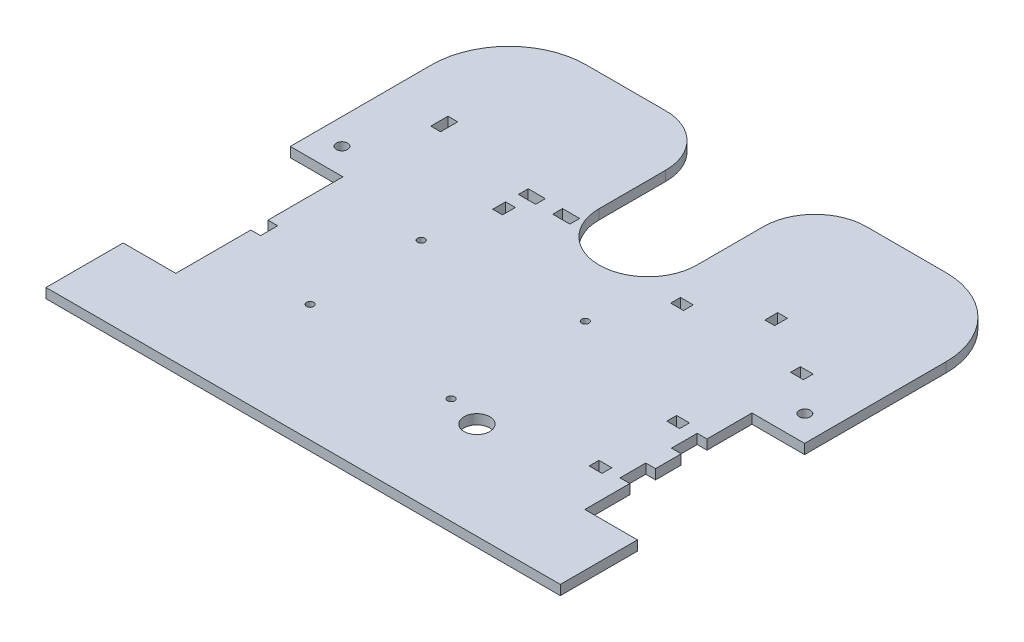
from build123d import *

# Parameters (mm, degrees)
SKETCH1_W           = 254
SKETCH1_H           = 228.6
BOSS_EXTRUDE1_DEPTH = 4.826
SKETCH2_W           = 26.00000007
SKETCH2_H           = 82.55
CUT_EXTRUDE1_DEPTH  = 4.826
CUT_EXTRUDE3_DEPTH  = 4.826
SKETCH17_R          = 2.778125
CUT_EXTRUDE14_DEPTH = 171.929167423
SKETCH18_W          = 4.826
SKETCH18_H          = 12.7
CUT_EXTRUDE15_DEPTH = 171.929167423
SKETCH19_W          = 4.826
SKETCH19_H          = 8.466666666
CUT_EXTRUDE16_DEPTH = 171.929167423
SKETCH20_W          = 6.35
SKETCH20_H          = 4.826
CUT_EXTRUDE17_DEPTH = 4.826
SKETCH21_R          = 1.778
CUT_EXTRUDE18_DEPTH = 171.929167423
SKETCH22_R          = 6.35
CUT_EXTRUDE19_DEPTH = 171.929167423
SKETCH24_R          = 24.13
CUT_EXTRUDE21_DEPTH = 171.929167423
SKETCH26_W          = 6.35
SKETCH26_H          = 4.826
SKETCH26_W_2        = 4.826
SKETCH26_H_2        = 6.35
CUT_EXTRUDE23_DEPTH = 171.929167423
SKETCH27_W          = 8.466666666
SKETCH27_H          = 4.826
SKETCH27_W_2        = 8.466666667
SKETCH27_W_3        = 4.826
SKETCH27_H_2        = 6.35
CUT_EXTRUDE24_DEPTH = 171.929167423
CUT_EXTRUDE25_DEPTH = 171.929167423
FILLET1_R           = 25.4


with BuildPart() as part:
    # Sketch1 → Boss-Extrude1 (new body)
    with BuildSketch(Plane(origin=(0, 0, 0), x_dir=(1, 0, 0), z_dir=(0, 1, 0))):
        Rectangle(SKETCH1_W, SKETCH1_H)
    extrude(amount=BOSS_EXTRUDE1_DEPTH)

    # Sketch2 → Cut-Extrude1 (cut)
    with BuildSketch(Plane(origin=(0, 4.826, 0), x_dir=(1, 0, 0), z_dir=(0, 1, 0))):
        with Locations((-113.999999965, -34.925)):
            Rectangle(SKETCH2_W, SKETCH2_H)
        with Locations((113.999999965, -34.925)):
            Rectangle(SKETCH2_W, SKETCH2_H)
    extrude(amount=-CUT_EXTRUDE1_DEPTH, mode=Mode.SUBTRACT)

    # Sketch4 → Cut-Extrude3 (cut)
    with BuildSketch(Plane(origin=(0, 4.826, 0), x_dir=(1, 0, 0), z_dir=(0, 1, 0))):
        with BuildLine():
            Line((-127, 76.2), (-127, 114.3))
            Line((-127, 114.3), (-88.9, 114.3))
            ThreePointArc((-88.9, 114.3), (-115.840768363, 103.140768363), (-127, 76.2))
        make_face()
        with BuildLine():
            Line((127, 76.2), (127, 114.3))
            Line((127, 114.3), (88.9, 114.3))
            ThreePointArc((88.9, 114.3), (115.840768363, 103.140768363), (127, 76.2))
        make_face()
    extrude(amount=-CUT_EXTRUDE3_DEPTH, mode=Mode.SUBTRACT)

    # Sketch17 → Cut-Extrude14 (cut, through all)
    with BuildSketch(Plane.XZ):
        with Locations((114.3, -19.164632523)):
            Circle(SKETCH17_R)
        with Locations((-114.3, -19.164632523)):
            Circle(SKETCH17_R)
    extrude(amount=-CUT_EXTRUDE14_DEPTH, mode=Mode.SUBTRACT)

    # Sketch18 → Cut-Extrude15 (cut, through all)
    with BuildSketch(Plane(origin=(0, 4.826, 0), x_dir=(1, 0, 0), z_dir=(0, 1, 0))):
        with Locations((98.58699993, -47.625)):
            Rectangle(SKETCH18_W, SKETCH18_H)
        with Locations((98.58699993, -22.225)):
            Rectangle(SKETCH18_W, SKETCH18_H)
    extrude(amount=-CUT_EXTRUDE15_DEPTH, mode=Mode.SUBTRACT)

    # Sketch19 → Cut-Extrude16 (cut, through all)
    with BuildSketch(Plane(origin=(0, 4.826, 0), x_dir=(1, 0, 0), z_dir=(0, 1, 0))):
        with Locations((-98.58699993, -34.925)):
            Rectangle(SKETCH19_W, SKETCH19_H)
        with Locations((-98.58699993, 53.975)):
            Rectangle(SKETCH19_W, SKETCH19_H)
    extrude(amount=-CUT_EXTRUDE16_DEPTH, mode=Mode.SUBTRACT)

    # Sketch20 → Cut-Extrude17 (cut)
    with BuildSketch(Plane.XZ):
        with Locations((86.64899993, 54.102)):
            Rectangle(SKETCH20_W, SKETCH20_H)
        with Locations((86.64899993, 15.748)):
            Rectangle(SKETCH20_W, SKETCH20_H)
    extrude(amount=-CUT_EXTRUDE17_DEPTH, mode=Mode.SUBTRACT)

    # Sketch21 → Cut-Extrude18 (cut, through all)
    with BuildSketch(Plane(origin=(0, 4.826, 0), x_dir=(1, 0, 0), z_dir=(0, 1, 0))):
        with Locations((-54.548927696, -56.293994427)):
            Circle(SKETCH21_R)
        with Locations((-54.548927696, -1.429994427)):
            Circle(SKETCH21_R)
        with Locations((20.635072304, -61.881994427)):
            Circle(SKETCH21_R)
        with Locations((20.635072304, 4.412005573)):
            Circle(SKETCH21_R)
    extrude(amount=-CUT_EXTRUDE18_DEPTH, mode=Mode.SUBTRACT)

    # Sketch22 → Cut-Extrude19 (cut, through all)
    with BuildSketch(Plane(origin=(0, 4.826, 0), x_dir=(1, 0, 0), z_dir=(0, 1, 0))):
        with Locations((37.84899924, -66.33273812)):
            Circle(SKETCH22_R)
    extrude(amount=-CUT_EXTRUDE19_DEPTH, mode=Mode.SUBTRACT)

    # Sketch24 → Cut-Extrude21 (cut, through all)
    with BuildSketch(Plane.XZ):
        with Locations((0, -55.982011538)):
            Circle(SKETCH24_R)
    extrude(amount=-CUT_EXTRUDE21_DEPTH, mode=Mode.SUBTRACT)

    # Sketch26 → Cut-Extrude23 (cut, through all)
    with BuildSketch(Plane(origin=(0, 4.826, 0), x_dir=(1, 0, 0), z_dir=(0, 1, 0))):
        with Locations((96.30099993, 35.687)):
            Rectangle(SKETCH26_W, SKETCH26_H)
        with Locations((66.83699993, 52.451)):
            Rectangle(SKETCH26_W_2, SKETCH26_H_2)
        with Locations((37.11899993, 35.687)):
            Rectangle(SKETCH26_W, SKETCH26_H)
    extrude(amount=-CUT_EXTRUDE23_DEPTH, mode=Mode.SUBTRACT)

    # Sketch27 → Cut-Extrude24 (cut, through all)
    with BuildSketch(Plane.XZ):
        with Locations((-45.903190174, -44.577)):
            Rectangle(SKETCH27_W, SKETCH27_H)
        with Locations((-28.969856841, -44.577)):
            Rectangle(SKETCH27_W_2, SKETCH27_H)
        with Locations((-47.723523507, -32.639)):
            Rectangle(SKETCH27_W_3, SKETCH27_H_2)
    extrude(amount=-CUT_EXTRUDE24_DEPTH, mode=Mode.SUBTRACT)

    # Sketch28 → Cut-Extrude25 (cut, through all)
    with BuildSketch(Plane(origin=(0, 4.826, 0), x_dir=(1, 0, 0), z_dir=(0, 1, 0))):
        with BuildLine():
            Line((-24.13, 114.3), (-24.13, 55.982011538))
            ThreePointArc((-24.13, 55.982011538), (0, 80.112011538), (24.13, 55.982011538))
            Line((24.13, 55.982011538), (24.13, 114.3))
            Line((24.13, 114.3), (-24.13, 114.3))
        make_face()
    extrude(amount=-CUT_EXTRUDE25_DEPTH, mode=Mode.SUBTRACT)

    # Fillet1
    fillet1_edges = [part.edges().sort_by_distance(p)[0] for p in [
        (-24.13, 2.413, -114.3),
        (24.13, 2.413, -114.3),
    ]]
    fillet(fillet1_edges, radius=FILLET1_R)


solid = part.part
